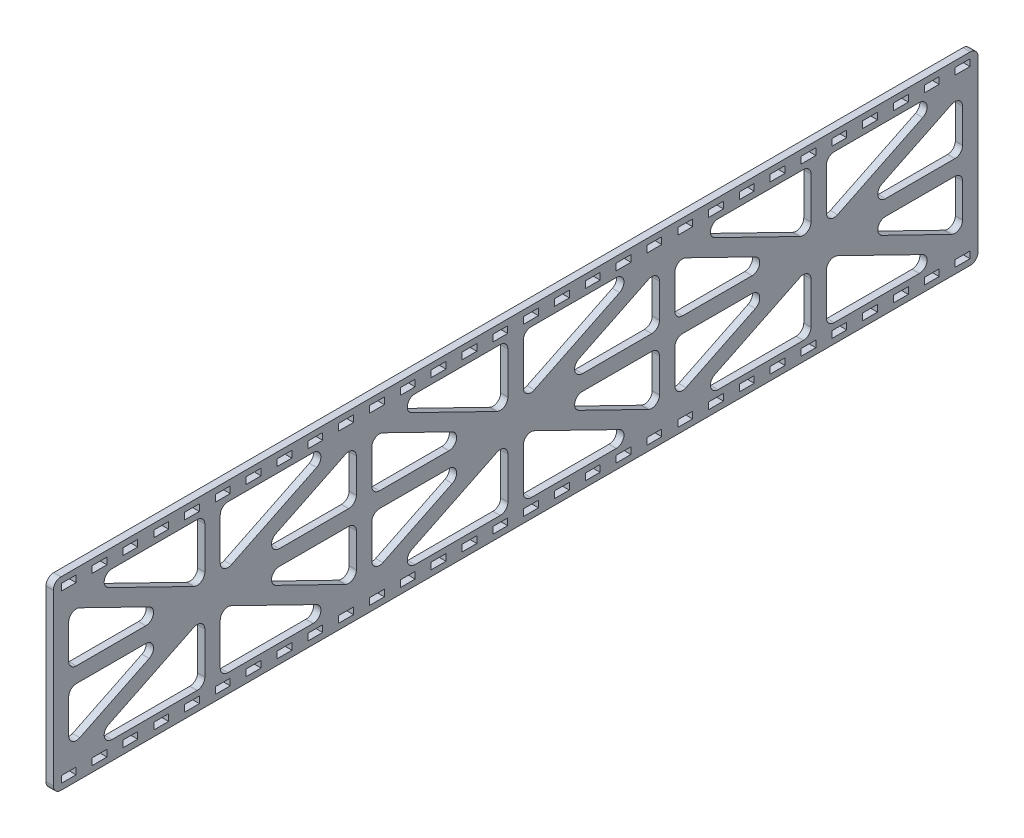
from build123d import *

# Parameters (mm, degrees)
SKETCH1_W          = 381
SKETCH1_H          = 76.2
OUTER_CUT_DEPTH    = 1.4986
CUT_EXTRUDE1_DEPTH = 195.295762197
FILLET1_R          = 3.175
SKETCH2_W          = 6.096
SKETCH2_H          = 2.746000096
SLOT_DEPTH         = 195.295762197
SLOTS_COUNT        = 16
SLOTS_PITCH        = 12.7
SLOTS_COUNT_DIR2   = 16
SLOTS_PITCH_DIR2   = 12.7


# Read off the part's stored shape, not the designer's step: Mirror1
with BuildPart() as part:
    # Sketch1 → Outer Cut (new, symmetric)
    with BuildSketch(Plane(origin=(0, 0, 0), x_dir=(0, 0, -1), z_dir=(1, 0, 0))):
        Rectangle(SKETCH1_W, SKETCH1_H)
    extrude(amount=OUTER_CUT_DEPTH, both=True)

    # Sketch3 → Cut-Extrude1 (cut, through all)
    with BuildSketch(Plane(origin=(1.4986, 0, 0), x_dir=(0, 0, -1), z_dir=(1, 0, 0))):
        Polygon((-184.15, 25.39709723), (-184.15, 3.175), (-138.625564702, 3.175), align=None)
        Polygon((-138.625564702, -3.175), (-184.15, -3.175), (-184.15, -25.39709723), align=None)
        Polygon((-128.058333333, 30.48), (-180.087108909, 30.48), (-128.058333333, 5.08290277), align=None)
        Polygon((-128.058333333, -5.08290277), (-180.087108909, -30.48), (-128.058333333, -30.48), align=None)
        Polygon((-121.708333333, -5.08290277), (-121.708333333, -30.48), (-69.679557758, -30.48), align=None)
        Polygon((-65.616666667, -3.175), (-111.141101964, -3.175), (-65.616666667, -25.39709723), align=None)
        Polygon((-65.616666667, 3.175), (-65.616666667, 25.39709723), (-111.141101964, 3.175), align=None)
        Polygon((-69.679557758, 30.48), (-121.708333333, 30.48), (-121.708333333, 5.08290277), align=None)
        Polygon((-13.742231369, 3.175), (-59.266666667, 25.39709723), (-59.266666667, 3.175), align=None)
        Polygon((-3.175, 30.48), (-55.203775575, 30.48), (-3.175, 5.08290277), align=None)
        Polygon((-13.742231369, -3.175), (-59.266666667, -3.175), (-59.266666667, -25.39709723), align=None)
        Polygon((-3.175, -5.08290277), (-55.203775575, -30.48), (-3.175, -30.48), align=None)
        Polygon((3.175, -5.08290277), (3.175, -30.48), (55.203775575, -30.48), align=None)
        Polygon((59.266666667, -25.39709723), (59.266666667, -3.175), (13.742231369, -3.175), align=None)
        Polygon((59.266666667, 3.175), (59.266666667, 25.39709723), (13.742231369, 3.175), align=None)
        Polygon((55.203775575, 30.48), (3.175, 30.48), (3.175, 5.08290277), align=None)
        Polygon((69.679557758, -30.48), (121.708333333, -30.48), (121.708333333, -5.08290277), align=None)
        Polygon((111.141101964, -3.175), (65.616666667, -3.175), (65.616666667, -25.39709723), align=None)
        Polygon((111.141101964, 3.175), (65.616666667, 25.39709723), (65.616666667, 3.175), align=None)
        Polygon((121.708333333, 5.08290277), (121.708333333, 30.48), (69.679557758, 30.48), align=None)
        Polygon((128.058333333, 5.08290277), (180.087108909, 30.48), (128.058333333, 30.48), align=None)
        Polygon((184.15, 3.175), (184.15, 25.39709723), (138.625564702, 3.175), align=None)
        Polygon((184.15, -25.39709723), (184.15, -3.175), (138.625564702, -3.175), align=None)
        Polygon((128.058333333, -30.48), (180.087108909, -30.48), (128.058333333, -5.08290277), align=None)
    extrude(amount=-CUT_EXTRUDE1_DEPTH, mode=Mode.SUBTRACT)

    # Fillet1
    fillet1_edges = [part.edges().sort_by_distance(p)[0] for p in [
        (0, -30.48, 55.203775575),
        (0, -5.08290277, 3.175),
        (0, -30.48, 3.175),
        (0, -3.175, 59.266666667),
        (0, -3.175, 13.742231369),
        (0, -25.39709723, 59.266666667),
        (0, 5.08290277, 3.175),
        (0, 30.48, 55.203775575),
        (0, 30.48, 3.175),
        (0, -5.08290277, -121.708333333),
        (0, -30.48, -121.708333333),
        (0, -30.48, -69.679557758),
        (0, 5.08290277, -3.175),
        (0, 30.48, -3.175),
        (0, 30.48, -55.203775575),
        (0, 25.39709723, -59.266666667),
        (0, 3.175, -59.266666667),
        (0, 3.175, -13.742231369),
        (0, -3.175, -59.266666667),
        (0, -25.39709723, -59.266666667),
        (0, -3.175, -13.742231369),
        (0, -5.08290277, 121.708333333),
        (0, -30.48, 69.679557758),
        (0, -30.48, 121.708333333),
        (0, -30.48, 128.058333333),
        (0, -30.48, 180.087108909),
        (0, -5.08290277, 128.058333333),
        (0, 5.08290277, 128.058333333),
        (0, 30.48, 180.087108909),
        (0, 30.48, 128.058333333),
        (0, -3.175, 138.625564702),
        (0, -25.39709723, 184.15),
        (0, -3.175, 184.15),
        (0, 25.39709723, 59.266666667),
        (0, 3.175, 13.742231369),
        (0, 3.175, 59.266666667),
        (0, 5.08290277, 121.708333333),
        (0, 30.48, 121.708333333),
        (0, 30.48, 69.679557758),
        (0, 25.39709723, 65.616666667),
        (0, 3.175, 65.616666667),
        (0, 3.175, 111.141101964),
        (0, -3.175, 65.616666667),
        (0, -25.39709723, 65.616666667),
        (0, -3.175, 111.141101964),
        (0, 3.175, -138.625564702),
        (0, 25.39709723, -184.15),
        (0, 3.175, -184.15),
        (0, -3.175, -138.625564702),
        (0, -3.175, -184.15),
        (0, -25.39709723, -184.15),
        (0, -5.08290277, -128.058333333),
        (0, -30.48, -180.087108909),
        (0, -30.48, -128.058333333),
        (0, -3.175, -65.616666667),
        (0, -3.175, -111.141101964),
        (0, -25.39709723, -65.616666667),
        (0, 25.39709723, -65.616666667),
        (0, 3.175, -111.141101964),
        (0, 3.175, -65.616666667),
        (0, 30.48, -121.708333333),
        (0, 5.08290277, -121.708333333),
        (0, 30.48, -69.679557758),
        (0, 5.08290277, -128.058333333),
        (0, 30.48, -128.058333333),
        (0, 30.48, -180.087108909),
        (0, 25.39709723, 184.15),
        (0, 3.175, 138.625564702),
        (0, 3.175, 184.15),
        (0, 38.1, 190.5),
        (0, 38.1, -190.5),
        (0, -38.1, -190.5),
        (0, -38.1, 190.5),
        (0, -5.08290277, -3.175),
        (0, -30.48, -55.203775575),
        (0, -30.48, -3.175),
    ]]
    fillet(fillet1_edges, radius=FILLET1_R)

    # Sketch2 → Slot (cut, through all)
    with BuildSketch(Plane(origin=(1.4986, 0, 0), x_dir=(0, 0, -1), z_dir=(1, 0, 0))):
        with Locations((6.35, 34.29)):
            Rectangle(SKETCH2_W, SKETCH2_H)
    slot = extrude(amount=-SLOT_DEPTH, mode=Mode.SUBTRACT)

    # Slots: Slot 16 × 16
    with Locations(*[Vector(0, 0, 1) * (i * SLOTS_PITCH) + Vector(0, 0, -1) * (j * SLOTS_PITCH_DIR2) for i in range(SLOTS_COUNT) for j in range(SLOTS_COUNT_DIR2) if (i, j) != (0, 0)]):
        add(slot, mode=Mode.SUBTRACT)

    # Mirror1
    split(bisect_by=Plane.ZX, keep=Keep.TOP)

    # Mirror1 2: part across plane


with BuildPart() as part_1:
    add(part.part)
    add(part.part.mirror(Plane.ZX))


solid = part_1.part
